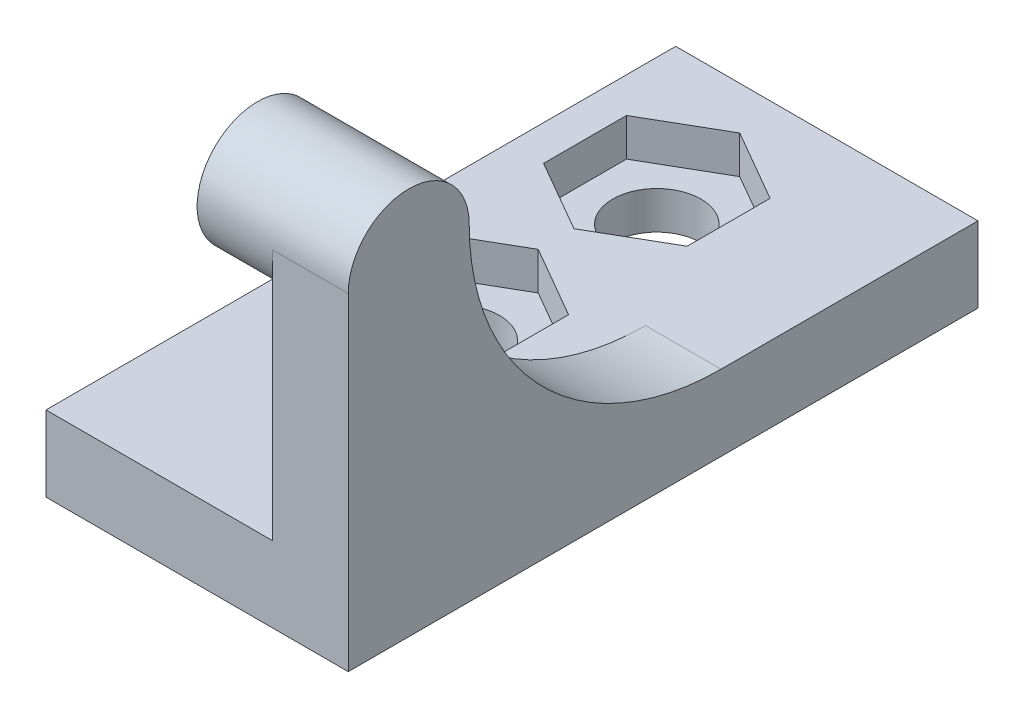
from build123d import *

# Parameters (mm, degrees)
ESQUISSE1_R             = 2.4
BOSS_EXTRU_1_DEPTH      = 3
BOSS_EXTRU_2_DEPTH      = 3
ESQUISSE3_W             = 12
ESQUISSE3_H             = 25
ESQUISSE3_R             = 1.75
BOSS_EXTRU_3_DEPTH      = 3
ENL_V_MAT_EXTRU_1_DEPTH = 1.5
CONG_1_R                = 10


with BuildPart() as part:
    # Esquisse1 → Boss.-Extru.1 (new body)
    with BuildSketch(Plane(origin=(0, 0, 0), x_dir=(0, 0, -1), z_dir=(1, 0, 0))):
        Circle(ESQUISSE1_R)
    extrude(amount=BOSS_EXTRU_1_DEPTH)

    # Esquisse2 → Boss.-Extru.2 (add)
    with BuildSketch(Plane(origin=(3, 0, 0), x_dir=(0, 0, -1), z_dir=(1, 0, 0))):
        with BuildLine():
            Line((-2.4, 0), (-2.4, -10))
            Line((-2.4, -10), (2.4, -10))
            Line((2.4, -10), (2.4, 0))
            ThreePointArc((2.4, 0), (0, 2.4), (-2.4, 0))
        make_face()
    extrude(amount=BOSS_EXTRU_2_DEPTH)

    # Esquisse3 → Boss.-Extru.3 (add)
    with BuildSketch(Plane.XZ.offset(10)):
        with Locations((0, -10.1)):
            Rectangle(ESQUISSE3_W, ESQUISSE3_H)
        with Locations(Location((-1.75, -9.6, 0), (0, 0, 270))):
            Circle(ESQUISSE3_R, mode=Mode.SUBTRACT)
        with Locations(Location((-1.75, -17.6, 0), (0, 0, 270))):
            Circle(ESQUISSE3_R, mode=Mode.SUBTRACT)
    extrude(amount=BOSS_EXTRU_3_DEPTH)

    # Esquisse4 → Enlèv. mat.-Extru.1 (cut)
    with BuildSketch(Plane(origin=(0, -10, 0), x_dir=(1, 0, 0), z_dir=(0, 1, 0))):
        Polygon((-4.6, 7.954551733), (-4.6, 11.245448267), (-1.75, 12.890896534), (1.1, 11.245448267), (1.1, 7.954551733), (-1.75, 6.309103466), align=None)
        Polygon((-4.6, 15.954551733), (-4.6, 19.245448267), (-1.75, 20.890896534), (1.1, 19.245448267), (1.1, 15.954551733), (-1.75, 14.309103466), align=None)
    extrude(amount=-ENL_V_MAT_EXTRU_1_DEPTH, mode=Mode.SUBTRACT)

    # Congé1
    cong_1_edges = [part.edges().sort_by_distance(p)[0] for p in [
        (4.5, -10, -2.4),
    ]]
    fillet(cong_1_edges, radius=CONG_1_R - 0.0001)  # a hair under: the kernel refuses the full size


solid = part.part
